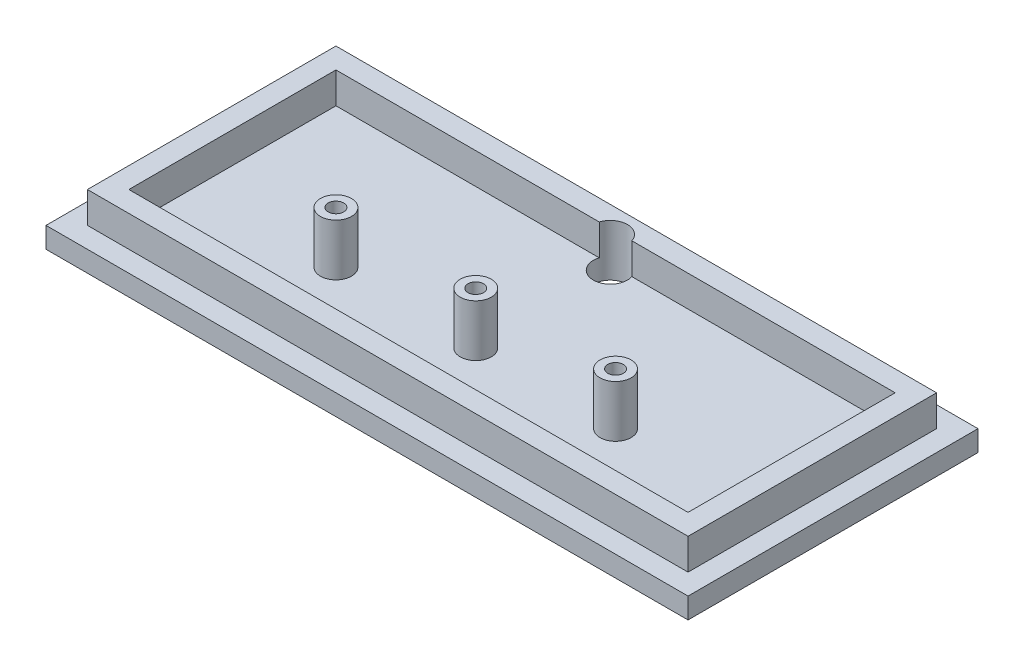
from build123d import *

# Parameters (mm, degrees)
SKETCH1_W                  = 62
SKETCH1_H                  = 28
BOSS_EXTRUDE1_DEPTH        = 2
SKETCH2_W                  = 58
SKETCH2_H                  = 24
SKETCH2_W_2                = 54
SKETCH2_H_2                = 20
BOSS_EXTRUDE2_DEPTH        = 3
SKETCH3_R                  = 1.5
SKETCH3_R_2                = 0.75
BOSS_EXTRUDE3_DEPTH        = 5
F_3_3_3_3_DIAMETER_HOLE1_D = 3.3


with BuildPart() as part:
    # Sketch1 → Boss-Extrude1 (new body)
    with BuildSketch(Plane(origin=(0, 0, 0), x_dir=(1, 0, 0), z_dir=(0, 1, 0))):
        with Locations((31, 14)):
            Rectangle(SKETCH1_W, SKETCH1_H)
    extrude(amount=BOSS_EXTRUDE1_DEPTH)

    # Sketch2 → Boss-Extrude2 (add)
    with BuildSketch(Plane(origin=(0, 2, 0), x_dir=(1, 0, 0), z_dir=(0, 1, 0))):
        with Locations((31, 14)):
            Rectangle(SKETCH2_W, SKETCH2_H)
        with Locations((31, 14)):
            Rectangle(SKETCH2_W_2, SKETCH2_H_2, mode=Mode.SUBTRACT)
    extrude(amount=BOSS_EXTRUDE2_DEPTH)

    # Sketch3 → Boss-Extrude3 (add)
    # profile 1 of 3: a face of its own
    with BuildSketch(Plane(origin=(0, 2, 0), x_dir=(1, 0, 0), z_dir=(0, 1, 0))):
        with Locations((17.5, 10.5)):
            Circle(SKETCH3_R)
        with Locations((17.5, 10.5)):
            Circle(SKETCH3_R_2, mode=Mode.SUBTRACT)
    # profile 2 of 3: a face of its own
    with BuildSketch(Plane(origin=(0, 2, 0), x_dir=(1, 0, 0), z_dir=(0, 1, 0))):
        with Locations((31, 10.5)):
            Circle(SKETCH3_R)
        with Locations((31, 10.5)):
            Circle(SKETCH3_R_2, mode=Mode.SUBTRACT)
    # profile 3 of 3: a face of its own
    with BuildSketch(Plane(origin=(0, 2, 0), x_dir=(1, 0, 0), z_dir=(0, 1, 0))):
        with Locations((44.5, 10.5)):
            Circle(SKETCH3_R)
        with Locations((44.5, 10.5)):
            Circle(SKETCH3_R_2, mode=Mode.SUBTRACT)
    extrude(amount=BOSS_EXTRUDE3_DEPTH)

    # Ø3.3 (3.3) Diameter Hole1 (through all)
    with Locations(Plane(origin=(0, 0, 0), x_dir=(-1, 0, 0), z_dir=(0, -1, 0))):
        with Locations((-31, 23.5)):
            Hole(F_3_3_3_3_DIAMETER_HOLE1_D / 2)


solid = part.part
